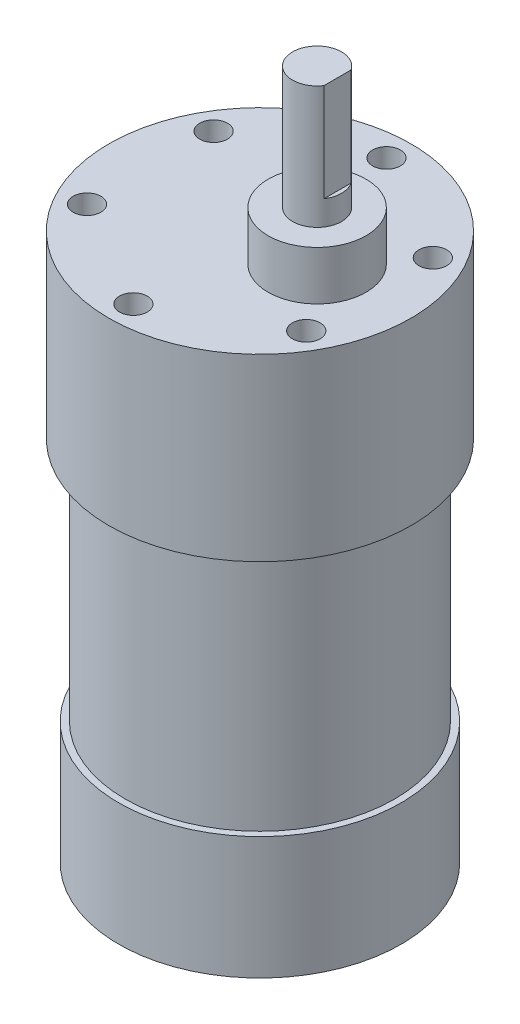
from build123d import *

# Parameters (mm, degrees)
SKETCH1_R                = 16.5
BOSS_EXTRUDE1_DEPTH      = 30
SKETCH2_R                = 2
BOSS_EXTRUDE2_DEPTH      = 2
SKETCH3_R                = 18.5
BOSS_EXTRUDE3_DEPTH      = 22
SKETCH5_R                = 6
BOSS_EXTRUDE4_DEPTH      = 6
SKETCH6_R                = 3
BOSS_EXTRUDE5_DEPTH      = 15
CUT_EXTRUDE1_START       = -12
CUT_EXTRUDE1_DEPTH       = 12
M3_CLEARANCE_HOLE1_D     = 3.4
M3_CLEARANCE_HOLE1_DEPTH = 10
M3_CLEARANCE_HOLE1_TIP   = 1.021463052
SKETCH16_R               = 17.3
BOSS_EXTRUDE6_DEPTH      = 15


with BuildPart() as part:
    # Sketch1 → Boss-Extrude1 (new body)
    with BuildSketch(Plane(origin=(0, 0, 0), x_dir=(1, 0, 0), z_dir=(0, 1, 0))):
        Circle(SKETCH1_R)
    extrude(amount=BOSS_EXTRUDE1_DEPTH)

    # Sketch2 → Boss-Extrude2 (add)
    with BuildSketch(Plane.XZ):
        Circle(SKETCH2_R)
    extrude(amount=BOSS_EXTRUDE2_DEPTH)

    # Sketch3 → Boss-Extrude3 (add)
    with BuildSketch(Plane(origin=(0, 30, 0), x_dir=(1, 0, 0), z_dir=(0, 1, 0))):
        Circle(SKETCH3_R)
    extrude(amount=BOSS_EXTRUDE3_DEPTH)

    # Sketch5 → Boss-Extrude4 (add)
    with BuildSketch(Plane(origin=(0, 52, 0), x_dir=(1, 0, 0), z_dir=(0, 1, 0))):
        with Locations((7, 0)):
            Circle(SKETCH5_R)
    extrude(amount=BOSS_EXTRUDE4_DEPTH)

    # Sketch6 → Boss-Extrude5 (add)
    with BuildSketch(Plane(origin=(0, 58, 0), x_dir=(1, 0, 0), z_dir=(0, 1, 0))):
        with Locations((7, 0)):
            Circle(SKETCH6_R)
    extrude(amount=BOSS_EXTRUDE5_DEPTH)

    # Sketch9 → Cut-Extrude1 (cut)
    with BuildSketch(Plane(origin=(0, 73, 0), x_dir=(1, 0, 0), z_dir=(0, 1, 0)).offset(CUT_EXTRUDE1_START)):
        with BuildLine():
            ThreePointArc((9.5, -1.658312395), (10, 0), (9.5, 1.658312395))
            Line((9.5, 1.658312395), (9.5, -1.658312395))
        make_face()
    extrude(amount=CUT_EXTRUDE1_DEPTH, mode=Mode.SUBTRACT)

    # M3 Clearance Hole1
    with Locations(Plane(origin=(0, 52, 0), x_dir=(1, 0, 0), z_dir=(0, 1, 0))):
        with Locations((0, -15.5), (-13.423393759, -7.75), (0, 15.5), (-13.423393759, 7.75), (13.423393759, -7.75), (13.423393759, 7.75)):
            Hole(M3_CLEARANCE_HOLE1_D / 2, depth=M3_CLEARANCE_HOLE1_DEPTH)
            with Locations((0, 0, -(M3_CLEARANCE_HOLE1_DEPTH + M3_CLEARANCE_HOLE1_TIP / 2))):  # 118° drill point
                Cone(0, M3_CLEARANCE_HOLE1_D / 2, M3_CLEARANCE_HOLE1_TIP, mode=Mode.SUBTRACT)

    # Sketch16 → Boss-Extrude6 (add)
    with BuildSketch(Plane.XZ):
        Circle(SKETCH16_R)
    extrude(amount=BOSS_EXTRUDE6_DEPTH)


solid = part.part
